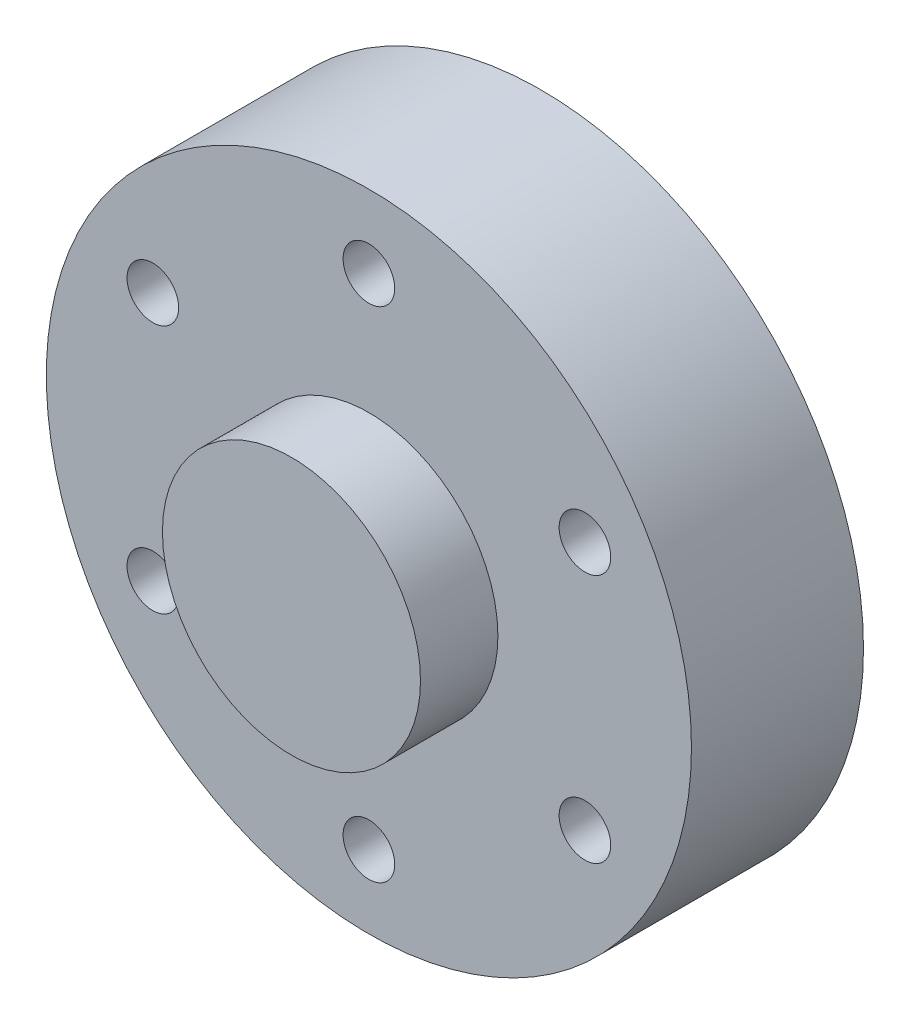
from build123d import *

# Parameters (mm, degrees)
SKETCH2_R           = 18.75
SKETCH2_R_2         = 1.5
BOSS_EXTRUDE1_DEPTH = 10
SKETCH3_R           = 7.5
BOSS_EXTRUDE2_DEPTH = 4.5
BOSS_EXTRUDE4_START = 4.5
SKETCH6_R           = 7.5
BOSS_EXTRUDE4_DEPTH = 4.5
SKETCH7_R           = 2
BOSS_EXTRUDE5_DEPTH = 1
FILLET2_R           = 0.05
CUT_EXTRUDE1_DEPTH  = 11


with BuildPart() as part:
    # Sketch2 → Boss-Extrude1 (new body)
    with BuildSketch(Plane.XY):
        Circle(SKETCH2_R)
        with Locations((0, -14.5)):
            Circle(SKETCH2_R_2, mode=Mode.SUBTRACT)
        with Locations((-12.557368355, -7.25)):
            Circle(SKETCH2_R_2, mode=Mode.SUBTRACT)
        with Locations((12.557368355, -7.25)):
            Circle(SKETCH2_R_2, mode=Mode.SUBTRACT)
        with Locations((-12.557368355, 7.25)):
            Circle(SKETCH2_R_2, mode=Mode.SUBTRACT)
        with Locations((0, 14.5)):
            Circle(SKETCH2_R_2, mode=Mode.SUBTRACT)
        with Locations((12.557368355, 7.25)):
            Circle(SKETCH2_R_2, mode=Mode.SUBTRACT)
    extrude(amount=BOSS_EXTRUDE1_DEPTH)

    # Sketch3 → Boss-Extrude2 (add)
    with BuildSketch(Plane.XY.offset(10)):
        Circle(SKETCH3_R)
    extrude(amount=BOSS_EXTRUDE2_DEPTH)

    # Sketch6 → Boss-Extrude4 (add)
    with BuildSketch(Plane(origin=(0, 0, 0), x_dir=(-1, 0, 0), z_dir=(0, 0, -1)).offset(BOSS_EXTRUDE4_START)):
        Circle(SKETCH6_R)
    extrude(amount=-BOSS_EXTRUDE4_DEPTH)

    # Sketch7 → Boss-Extrude5 (add)
    with BuildSketch(Plane(origin=(0, 0, -4.5), x_dir=(-1, 0, 0), z_dir=(0, 0, -1))):
        Circle(SKETCH7_R)
    extrude(amount=BOSS_EXTRUDE5_DEPTH)

    # Fillet2
    fillet2_edges = [part.edges().sort_by_distance(p)[0] for p in [
        (2, 0, -5.5),
    ]]
    fillet(fillet2_edges, radius=FILLET2_R)

    # Sketch9 → Cut-Extrude1 (cut)
    with BuildSketch(Plane(origin=(0, 0, -5.5), x_dir=(-1, 0, 0), z_dir=(0, 0, -1))):
        with BuildLine():
            Line((-0.828120612, 1.250686312), (0.828120612, 1.250686312))
            ThreePointArc((0.828120612, 1.250686312), (0, -1.5), (-0.828120612, 1.250686312))
        make_face()
    extrude(amount=-CUT_EXTRUDE1_DEPTH, mode=Mode.SUBTRACT)


solid = part.part
